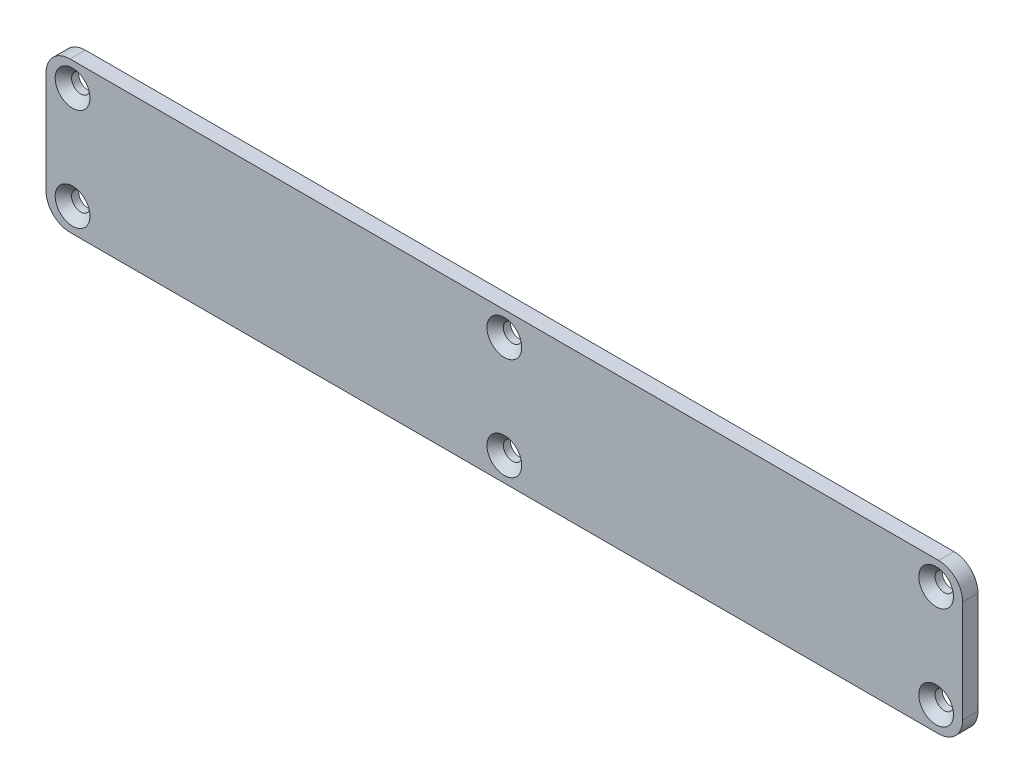
from build123d import *

# Parameters (mm, degrees)
SKETCH1_W           = 180
SKETCH1_H           = 30
BOSS_EXTRUDE1_DEPTH = 3
FILLET1_R           = 5
CUT_EXTRUDE1_DEPTH  = 92.290744328


# Read off the part's stored shape, not the designer's step: CSK for M3 Flat Head Machine Screw1
with BuildPart() as part:
    # Sketch1 → Boss-Extrude1 (new body)
    with BuildSketch(Plane.XY):
        Rectangle(SKETCH1_W, SKETCH1_H)
    extrude(amount=BOSS_EXTRUDE1_DEPTH)

    # Fillet1
    fillet1_edges = [part.edges().sort_by_distance(p)[0] for p in [
        (90, -15, 1.5),
        (-90, -15, 1.5),
        (-90, 15, 1.5),
        (90, 15, 1.5),
    ]]
    fillet(fillet1_edges, radius=FILLET1_R)

    # CSK for M3 Flat Head Machine Screw1 outl → CSK for M3 Flat Head Machine Screw1 (revolve, cut)
    with BuildSketch(Plane.XZ.offset(10)):
        Polygon((0, 0), (1.8, 0), (1.8, 1.4), (3.4, 3), (0, 3), align=None)
    revolve(axis=Axis((0, -10, 0), (0, 0, 1)), mode=Mode.SUBTRACT)

    # CSK for M3 Flat Head Machine Screw1 2 ou → CSK for M3 Flat Head Machine Screw1 2 (revolve, cut)
    with BuildSketch(Plane.XZ.offset(-10)):
        Polygon((0, 0), (1.8, 0), (1.8, 1.4), (3.4, 3), (0, 3), align=None)
    revolve(axis=Axis((0, 10, 0), (0, 0, 1)), mode=Mode.SUBTRACT)

    # CSK for M3 Flat Head Machine Screw1 3 ou → CSK for M3 Flat Head Machine Screw1 3 (revolve, cut)
    with BuildSketch(Plane(origin=(-84.5, -10, 0), x_dir=(1, 0, 0), z_dir=(0, -1, 0))):
        Polygon((0, 0), (1.8, 0), (1.8, 1.4), (3.4, 3), (0, 3), align=None)
    revolve(axis=Axis((-84.5, -10, 0), (0, 0, 1)), mode=Mode.SUBTRACT)

    # CSK for M3 Flat Head Machine Screw1 4 ou → CSK for M3 Flat Head Machine Screw1 4 (revolve, cut)
    with BuildSketch(Plane(origin=(84.5, 10, 0), x_dir=(1, 0, 0), z_dir=(0, -1, 0))):
        Polygon((0, 0), (1.8, 0), (1.8, 1.4), (3.4, 3), (0, 3), align=None)
    revolve(axis=Axis((84.5, 10, 0), (0, 0, 1)), mode=Mode.SUBTRACT)

    # CSK for M3 Flat Head Machine Screw1 5 ou → CSK for M3 Flat Head Machine Screw1 5 (revolve, cut)
    with BuildSketch(Plane(origin=(84.5, -10, 0), x_dir=(1, 0, 0), z_dir=(0, -1, 0))):
        Polygon((0, 0), (1.8, 0), (1.8, 1.4), (3.4, 3), (0, 3), align=None)
    revolve(axis=Axis((84.5, -10, 0), (0, 0, 1)), mode=Mode.SUBTRACT)

    # CSK for M3 Flat Head Machine Screw1 6 ou → CSK for M3 Flat Head Machine Screw1 6 (revolve, cut)
    with BuildSketch(Plane(origin=(-84.5, 10, 0), x_dir=(1, 0, 0), z_dir=(0, -1, 0))):
        Polygon((0, 0), (1.8, 0), (1.8, 1.4), (3.4, 3), (0, 3), align=None)
    revolve(axis=Axis((-84.5, 10, 0), (0, 0, 1)), mode=Mode.SUBTRACT)

    # Sketch5 → Cut-Extrude1 (cut, through all)
    with BuildSketch(Plane.XY.offset(3)):
        with BuildLine():
            Line((-85, -15), (85, -15))
            ThreePointArc((85, -15), (88.535533906, -13.535533906), (90, -10))
            Line((90, -10), (90, 10))
            ThreePointArc((90, 10), (88.535533906, 13.535533906), (85, 15))
            Line((85, 15), (-85, 15))
            ThreePointArc((-85, 15), (-88.535533906, 13.535533906), (-90, 10))
            Line((-90, 10), (-90, -10))
            ThreePointArc((-90, -10), (-88.535533906, -13.535533906), (-85, -15))
        make_face()
        with BuildLine():
            Line((-85, -14.7), (85, -14.7))
            ThreePointArc((85, -14.7), (88.323401872, -13.323401872), (89.7, -10))
            Line((89.7, -10), (89.7, 10))
            ThreePointArc((89.7, 10), (88.323401872, 13.323401872), (85, 14.7))
            Line((85, 14.7), (-85, 14.7))
            ThreePointArc((-85, 14.7), (-88.323401872, 13.323401872), (-89.7, 10))
            Line((-89.7, 10), (-89.7, -10))
            ThreePointArc((-89.7, -10), (-88.323401872, -13.323401872), (-85, -14.7))
        make_face(mode=Mode.SUBTRACT)
    extrude(amount=-CUT_EXTRUDE1_DEPTH, mode=Mode.SUBTRACT)


solid = part.part
